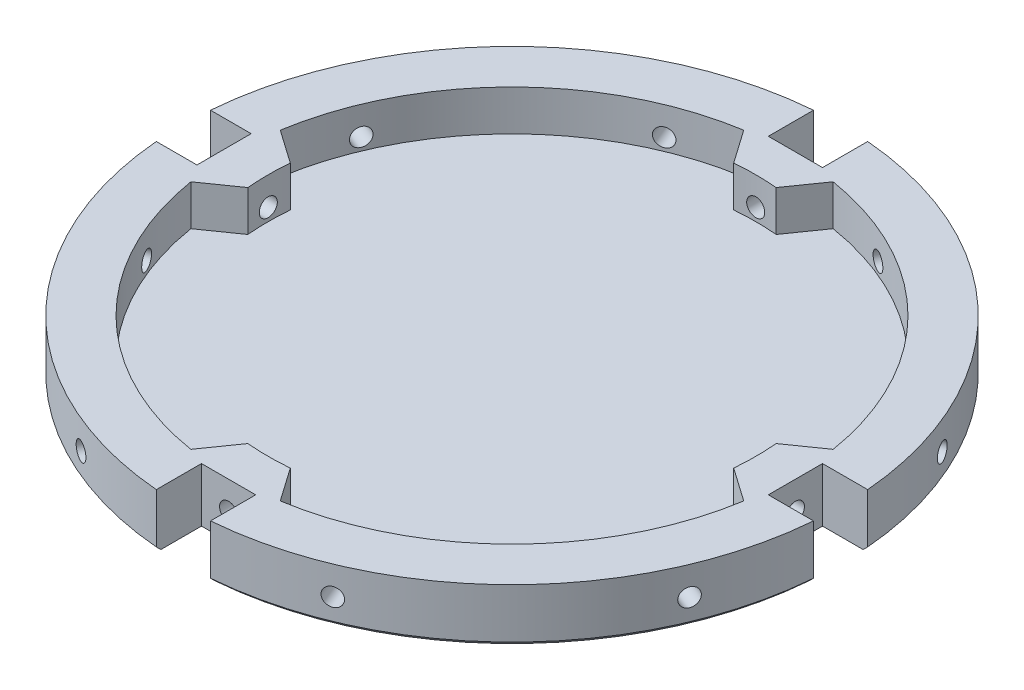
from build123d import *

# Parameters (mm, degrees)
TAGLIO_ESTRUSIONE1_START              = -12
TAGLIO_ESTRUSIONE1_DEPTH              = 12
TAGLIO_ESTRUSIONE3_DEPTH              = 10
SMUSSO1_SIZE                          = 1
SMUSSO2_SIZE                          = 1
RACCORDO1_R                           = 1
SMUSSO3_SIZE                          = 1
RIPETIZIONECIRCOLARE5_COUNT           = 8
SMUSSO3_OF_RIPETIZIONECIRCOLARE5_SIZE = 1
RIPETIZIONECIRCOLARE7_COUNT           = 8
ESTRUSIONE_ESTRUSIONE1_DEPTH          = 11
RIPETIZIONECIRCOLARE8_COUNT           = 4
SCHIZZO12_R                           = 2
TAGLIO_ESTRUSIONE5_DEPTH              = 10
RIPETIZIONECIRCOLARE9_COUNT           = 4
TAGLIO_ESTRUSIONE6_START              = -12
SCHIZZO13_R                           = 75
TAGLIO_ESTRUSIONE6_DEPTH              = 12
SMUSSO4_SIZE                          = 8
SMUSSO5_SIZE                          = 8


with BuildPart() as part:
    # Schizzo1 → Rivoluzione1 (revolve)
    with BuildSketch(Plane.XY, mode=Mode.PRIVATE) as rivoluzione1_sk:
        Polygon((-73, 24), (-62, 24), (-62, 3), (0, 3), (0, 0), (-73, 0), (-73, 12), (-75, 12), (-75, 14), (-73, 14), align=None)
    revolve(rivoluzione1_sk.sketch.rotate(Axis((0, 0, 0), (0, 1, 0)), 270), axis=Axis((0, 0, 0), (0, 1, 0)))

    # Schizzo2 → Taglio-Estrusione1 (cut)
    with BuildSketch(Plane.XZ.offset(TAGLIO_ESTRUSIONE1_START)):
        with BuildLine():
            Line((-72.753006811, 6), (-62.753006811, 6))
            Line((-62.753006811, 6), (-62.753006811, -6))
            Line((-62.753006811, -6), (-72.753006811, -6))
            ThreePointArc((-72.753006811, -6), (-73, 0), (-72.753006811, 6))
        make_face()
    taglio_estrusione1 = extrude(amount=TAGLIO_ESTRUSIONE1_DEPTH, mode=Mode.SUBTRACT)

    # Schizzo3 → Taglio-Estrusione3 (cut)
    with BuildSketch(Plane(origin=(0, 24, 0), x_dir=(1, 0, 0), z_dir=(0, 1, 0))):
        with BuildLine():
            ThreePointArc((-54.71557638, 29.158287011), (-49.821919988, 36.902253166), (-43.840620434, 43.840620434))
            Line((-43.840620434, 43.840620434), (-51.618795027, 51.618795027))
            ThreePointArc((-51.618795027, 51.618795027), (-58.661292889, 43.449427115), (-64.423178641, 34.331531481))
            Line((-64.423178641, 34.331531481), (-54.71557638, 29.158287011))
        make_face()
        with BuildLine():
            ThreePointArc((-62, 0), (-61.32325093, 9.13558402), (-59.307777568, 18.071732621))
            Line((-59.307777568, 18.071732621), (-69.830125201, 21.278007764))
            ThreePointArc((-69.830125201, 21.278007764), (-72.203182546, 10.756413443), (-73, 0))
            Line((-73, 0), (-62, 0))
        make_face()
    taglio_estrusione3 = extrude(amount=-TAGLIO_ESTRUSIONE3_DEPTH, mode=Mode.SUBTRACT)

    # Schizzo5 → Foro Ø4.0 (4)-1 (revolve, cut)
    with BuildSketch(Plane(origin=(-67.481156182, 18.52127967, -27.844093814), x_dir=(-0.3814259426553719, 0, 0.9243993997561125), z_dir=(0, 1, 0))):
        Polygon((0, 0), (0, 19), (2, 17.798278762), (2, 0), align=None)
    foro_4_0_4_1 = revolve(axis=Axis((-73.351092371, 18.52127967, -30.26614855), (0.9243993997561125, 0, 0.3814259426553719)), mode=Mode.SUBTRACT)

    # Schizzo7 → Foro Ø4.0 (4)-2 (revolve, cut)
    with BuildSketch(Plane(origin=(-62.753006811, 5.770781284, 0), x_dir=(0, 0, 1), z_dir=(0, 1, 0))):
        Polygon((0, 0), (0, 19), (2, 17.798278762), (2, 0), align=None)
    foro_4_0_4_2 = revolve(axis=Axis((-69.103006811, 5.770781284, 0), (1, 0, 0)), mode=Mode.SUBTRACT)

    # Smusso1
    smusso1_edges = [part.edges().sort_by_distance(p)[0] for p in [
        (73, 0, 0),
    ]]
    chamfer(smusso1_edges, length=SMUSSO1_SIZE)

    # Smusso2
    smusso2_edges = [part.edges().sort_by_distance(p)[0] for p in [
        (-62.753006811, 0, 0),
    ]]
    chamfer(smusso2_edges, length=SMUSSO2_SIZE)

    # Raccordo1
    raccordo1_edges = [part.edges().sort_by_distance(p)[0] for p in [
        (-62.753006811, 12, 0),
    ]]
    fillet(raccordo1_edges, radius=RACCORDO1_R)

    # Smusso3
    smusso3_edges = [part.edges().sort_by_distance(p)[0] for p in [
        (-67.443205873, 24, -27.935890563),
    ]]
    chamfer(smusso3_edges, length=SMUSSO3_SIZE)

    # RipetizioneCircolare5: Taglio-Estrusione3, Foro Ø4.0 (4)-1 ×8 about axis
    ripetizionecircolare5_axis = Axis((0, 0, 0), (0, 1, 0))
    add([taglio_estrusione3.rotate(ripetizionecircolare5_axis, i * 360 / RIPETIZIONECIRCOLARE5_COUNT) for i in range(1, RIPETIZIONECIRCOLARE5_COUNT)], mode=Mode.SUBTRACT)
    add([foro_4_0_4_1.rotate(ripetizionecircolare5_axis, i * 360 / RIPETIZIONECIRCOLARE5_COUNT) for i in range(1, RIPETIZIONECIRCOLARE5_COUNT)], mode=Mode.SUBTRACT)

    # Smusso3 of RipetizioneCircolare5
    smusso3_of_ripetizionecircolare5_edges = [part.edges().sort_by_distance(p)[0] for p in [
        (-67.443205873, 24, 27.935890563),
        (-27.935890563, 24, 67.443205873),
        (27.935890563, 24, 67.443205873),
        (67.443205873, 24, 27.935890563),
        (67.443205873, 24, -27.935890563),
        (27.935890563, 24, -67.443205873),
        (-27.935890563, 24, -67.443205873),
    ]]
    chamfer(smusso3_of_ripetizionecircolare5_edges, length=SMUSSO3_OF_RIPETIZIONECIRCOLARE5_SIZE)

    # Schizzo9 → Foro Ø4.0 (4)-3 (revolve, cut)
    with BuildSketch(Plane(origin=(-67.49725461, 5.708772693, 27.805046666), x_dir=(0.38089105022137115, 0, 0.924619926164941), z_dir=(0, 1, 0))):
        Polygon((0, 0), (0, 19), (2, 17.798278762), (2, 0), align=None)
    foro_4_0_4_3 = revolve(axis=Axis((-73.368591141, 5.708772693, 30.223704835), (0.9246199261649409, 0, -0.3808910502213711)), mode=Mode.SUBTRACT)

    # RipetizioneCircolare7: Foro Ø4.0 (4)-3 ×8 about axis
    ripetizionecircolare7_axis = Axis((0, 1, 0), (0, -1, 0))
    for i in range(1, RIPETIZIONECIRCOLARE7_COUNT):
        add(foro_4_0_4_3.rotate(ripetizionecircolare7_axis, i * 360 / RIPETIZIONECIRCOLARE7_COUNT), mode=Mode.SUBTRACT)

    # Schizzo11 → Estrusione-Estrusione1 (add)
    with BuildSketch(Plane(origin=(0, 3, 0), x_dir=(1, 0, 0), z_dir=(0, 1, 0))):
        with BuildLine():
            Line((-5.40365605, 61.764071282), (-4.706410108, 53.794513697))
            ThreePointArc((-4.706410108, 53.794513697), (0, 54), (4.706410108, 53.794513697))
            Line((4.706410108, 53.794513697), (5.40365605, 61.764071282))
            ThreePointArc((5.40365605, 61.764071282), (0, 62), (-5.40365605, 61.764071282))
        make_face()
    estrusione_estrusione1 = extrude(amount=ESTRUSIONE_ESTRUSIONE1_DEPTH)

    # RipetizioneCircolare8: Estrusione-Estrusione1 ×4 about axis
    ripetizionecircolare8_axis = Axis((0, 0, 0), (0, -1, 0))
    for i in range(1, RIPETIZIONECIRCOLARE8_COUNT):
        add(estrusione_estrusione1.rotate(ripetizionecircolare8_axis, i * 360 / RIPETIZIONECIRCOLARE8_COUNT))

    # Schizzo12 → Taglio-Estrusione5 (cut)
    with BuildSketch(Plane.ZY.offset(62.753006811)):
        with Locations((0, 5.770781284)):
            Circle(SCHIZZO12_R)
    extrude(amount=-TAGLIO_ESTRUSIONE5_DEPTH, mode=Mode.SUBTRACT)

    # RipetizioneCircolare9: Taglio-Estrusione1, Foro Ø4.0 (4)-2 ×4 about axis
    ripetizionecircolare9_axis = Axis((0, 0, 0), (0, 1, 0))
    add([taglio_estrusione1.rotate(ripetizionecircolare9_axis, i * 360 / RIPETIZIONECIRCOLARE9_COUNT) for i in range(1, RIPETIZIONECIRCOLARE9_COUNT)], mode=Mode.SUBTRACT)
    add([foro_4_0_4_2.rotate(ripetizionecircolare9_axis, i * 360 / RIPETIZIONECIRCOLARE9_COUNT) for i in range(1, RIPETIZIONECIRCOLARE9_COUNT)], mode=Mode.SUBTRACT)

    # Schizzo13 → Taglio-Estrusione6 (cut)
    with BuildSketch(Plane(origin=(0, 24, 0), x_dir=(1, 0, 0), z_dir=(0, 1, 0)).offset(TAGLIO_ESTRUSIONE6_START)):
        Circle(SCHIZZO13_R)
    extrude(amount=TAGLIO_ESTRUSIONE6_DEPTH, mode=Mode.SUBTRACT)

    # Smusso4
    # the kernel refuses this chamfer: 8, 4.618802154 mm, written as the material it adds along each edge
    with BuildSketch(Plane(origin=(-61.764071282, -17.696686037, 5.40365605), x_dir=(0.1234621635577304, 0, 0.9923492803290805), z_dir=(0, 1, 0))) as smusso4_piece_1_section:
        with BuildLine():
            Line((4.526423356, 0), (SMUSSO4_SIZE * 0.036503414159, SMUSSO4_SIZE * 0.999333528285))
            Line((SMUSSO4_SIZE * 0.036503414159, SMUSSO4_SIZE * 0.999333528285), (0, 0))
            ThreePointArc((0, 0), (2.337979566, -0.041276164), (4.526423356, 0))
        make_face()
    smusso4_piece_1 = extrude(amount=29.696686037, mode=Mode.PRIVATE)
    smusso4_piece_1 = split(smusso4_piece_1, bisect_by=Plane(origin=(-52.910196028, -8.842810783, 5.40365605), z_dir=(0.7071067811865476, 0.7071067811865476, 0)), keep=Keep.TOP, mode=Mode.PRIVATE)
    smusso4_piece_1 = split(smusso4_piece_1, bisect_by=Plane(origin=(-61.764071282, 0, 5.40365605), z_dir=(0, 1, 0)), keep=Keep.TOP, mode=Mode.PRIVATE)
    add(smusso4_piece_1)
    with BuildSketch(Plane(origin=(-61.764071282, -17.696686037, -5.40365605), x_dir=(0.9961946980917455, 0, 0.08715574274765804), z_dir=(0, 1, 0))) as smusso4_piece_2_section:
        with BuildLine():
            Line((SMUSSO4_SIZE, 0), (0.165229906, 4.523406623))
            ThreePointArc((0.165229906, 4.523406623), (0.044095582, 2.337928089), (0, 0))
            Line((0, 0), (SMUSSO4_SIZE, 0))
        make_face()
    smusso4_piece_2 = extrude(amount=29.696686037, mode=Mode.PRIVATE)
    smusso4_piece_2 = split(smusso4_piece_2, bisect_by=Plane(origin=(-52.910196028, -8.842810783, -5.40365605), z_dir=(0.7071067811865476, 0.7071067811865476, 0)), keep=Keep.TOP, mode=Mode.PRIVATE)
    smusso4_piece_2 = split(smusso4_piece_2, bisect_by=Plane(origin=(-61.764071282, 0, -5.40365605), z_dir=(0, 1, 0)), keep=Keep.TOP, mode=Mode.PRIVATE)
    add(smusso4_piece_2)

    # Smusso5
    # the kernel refuses this chamfer: 8, 4.618802154 mm, written as the material it adds along each edge
    with BuildSketch(Plane(origin=(61.764071282, 3, -5.40365605), x_dir=(-0.9961946980917455, 0, 0.0871557427476583), z_dir=(0, 1, 0)), Plane(origin=(5.40365605, 3, 61.764071282), x_dir=(-0.0871557427476583, 0, -0.9961946980917455), z_dir=(0, 1, 0))) as smusso5_piece_1:
        with BuildLine():
            Line((SMUSSO5_SIZE, 0), (0.165229906, -4.523406623))
            ThreePointArc((0.165229906, -4.523406623), (0.044095582, -2.337928089), (0, 0))
            Line((0, 0), (SMUSSO5_SIZE, 0))
        make_face()
    extrude(amount=9)
    with BuildSketch(Plane(origin=(-5.40365605, 3, 61.764071282), x_dir=(-0.9923492803290818, 0, -0.12346216355772176), z_dir=(0, 1, 0)), Plane(origin=(61.764071282, 3, 5.40365605), x_dir=(-0.12346216355772323, 0, 0.9923492803290817), z_dir=(0, 1, 0)), Plane(origin=(5.40365605, 3, -61.764071282), x_dir=(0.9923492803290817, 0, 0.1234621635577217), z_dir=(0, 1, 0))) as smusso5_piece_2:
        with BuildLine():
            Line((4.526423356, 0), (SMUSSO5_SIZE * 0.036503414159, -SMUSSO5_SIZE * 0.999333528285))
            Line((SMUSSO5_SIZE * 0.036503414159, -SMUSSO5_SIZE * 0.999333528285), (0, 0))
            ThreePointArc((0, 0), (2.337979566, 0.041276164), (4.526423356, 0))
        make_face()
    extrude(amount=9)
    with BuildSketch(Plane(origin=(-5.40365605, 3, -61.764071282), x_dir=(-0.9923492803290808, 0, 0.12346216355772907), z_dir=(0, 1, 0))) as smusso5_piece_3:
        with BuildLine():
            Line((4.526423356, 0), (SMUSSO5_SIZE * 0.036503414159, SMUSSO5_SIZE * 0.999333528285))
            Line((SMUSSO5_SIZE * 0.036503414159, SMUSSO5_SIZE * 0.999333528285), (0, 0))
            ThreePointArc((0, 0), (2.337979566, -0.041276164), (4.526423356, 0))
        make_face()
    extrude(amount=9)


solid = part.part
